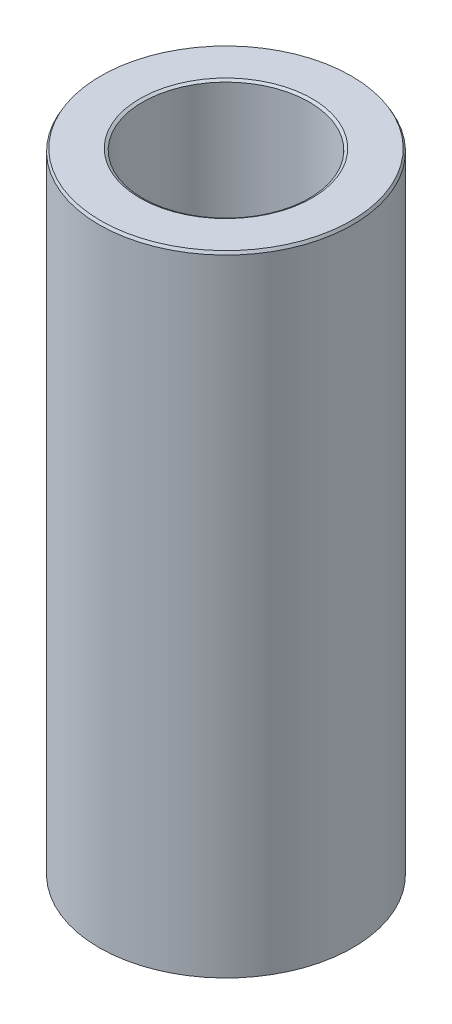
from build123d import *
from OCP.BRepFilletAPI import BRepFilletAPI_MakeChamfer

# Parameters (mm, degrees)
SKETCH1_R           = 15
BOSS_EXTRUDE1_DEPTH = 74.508117738
SKETCH2_R           = 9.852316326
CUT_EXTRUDE1_DEPTH  = 78.469088086
CHAMFER1_SIZE       = 0.32402622
CHAMFER1_SIZE2      = 0.187076625


with BuildPart() as part:
    # Sketch1 → Boss-Extrude1 (new body)
    with BuildSketch(Plane(origin=(0, 0, 0), x_dir=(1, 0, 0), z_dir=(0, 1, 0))):
        Circle(SKETCH1_R)
    extrude(amount=BOSS_EXTRUDE1_DEPTH)

    # Sketch2 → Cut-Extrude1 (cut, through all)
    with BuildSketch(Plane(origin=(0, 0, 0), x_dir=(1, 0, 0), z_dir=(0, 1, 0))):
        Circle(SKETCH2_R)
    extrude(amount=CUT_EXTRUDE1_DEPTH, mode=Mode.SUBTRACT)

    # Chamfer1: one chamfer whose edges measure the first distance from different faces: ONE call of the kernel's chamfer builder (chamfer() names one face for all edges)
    chamfer1_edges_1 = [part.edges().sort_by_distance(p)[0] for p in [
        (-9.852316326, 74.508117738, 0),
    ]]
    chamfer1_side_1 = [part.faces().sort_by_distance(p)[0] for p in [
        (-14.575735931, 74.508117738, 0),
    ]]
    chamfer1_edges_2 = [part.edges().sort_by_distance(p)[0] for p in [
        (-9.852316326, 0, 0),
    ]]
    chamfer1_side_2 = [part.faces().sort_by_distance(p)[0] for p in [
        (-9.852316326, 37.254058869, 0),
    ]]
    chamfer1_edges_3 = [part.edges().sort_by_distance(p)[0] for p in [
        (-15, 0, 0),
    ]]
    chamfer1_side_3 = [part.faces().sort_by_distance(p)[0] for p in [
        (-14.575735931, 0, 0),
    ]]
    chamfer1_edges_4 = [part.edges().sort_by_distance(p)[0] for p in [
        (-15, 74.508117738, 0),
    ]]
    chamfer1_side_4 = [part.faces().sort_by_distance(p)[0] for p in [
        (-15, 37.254058869, 0),
    ]]
    chamfer1 = BRepFilletAPI_MakeChamfer(part.part.solid().wrapped)
    for e in chamfer1_edges_1:
        chamfer1.Add(CHAMFER1_SIZE, CHAMFER1_SIZE2, e.wrapped, chamfer1_side_1[0].wrapped)  # the first distance lies on this face
    for e in chamfer1_edges_2:
        chamfer1.Add(CHAMFER1_SIZE, CHAMFER1_SIZE2, e.wrapped, chamfer1_side_2[0].wrapped)  # the first distance lies on this face
    for e in chamfer1_edges_3:
        chamfer1.Add(CHAMFER1_SIZE, CHAMFER1_SIZE2, e.wrapped, chamfer1_side_3[0].wrapped)  # the first distance lies on this face
    for e in chamfer1_edges_4:
        chamfer1.Add(CHAMFER1_SIZE, CHAMFER1_SIZE2, e.wrapped, chamfer1_side_4[0].wrapped)  # the first distance lies on this face
    add(Compound.cast(chamfer1.Shape()), mode=Mode.REPLACE)


solid = part.part
